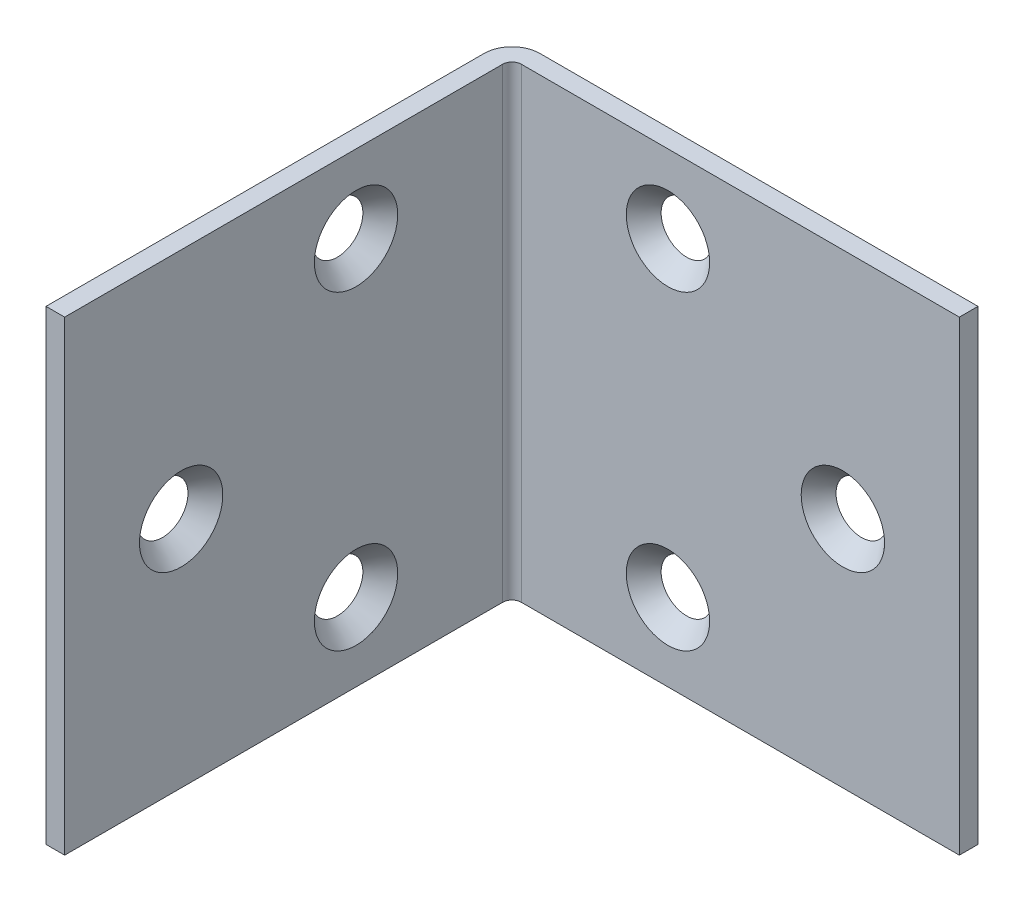
from build123d import *

# Parameters (mm, degrees)
EXTRUDE_THIN1_START          = -19.05
EXTRUDE_THIN1_DEPTH          = 38.1
SKETCH4_R                    = 2.0828
EXTRUDE3_DEPTH               = 57.145492036
SKETCH5_R                    = 2.0828
CUT_EXTRUDE1_DEPTH           = 2.54
CUT_EXTRUDE1_DRAFT           = 41
CUT_EXTRUDE1_PROFILE_2_DEPTH = 2.54
CUT_EXTRUDE1_PROFILE_2_DRAFT = 41
CUT_EXTRUDE1_PROFILE_3_DEPTH = 2.54
CUT_EXTRUDE1_PROFILE_3_DRAFT = 41
MIRROR1_COPY_1_SKETCH_R      = 2.0828
MIRROR1_COPY_1_DEPTH         = 2.54
MIRROR1_COPY_1_DRAFT         = 41
MIRROR1_COPY_2_SKETCH_R      = 2.0828
MIRROR1_COPY_2_DEPTH         = 2.54
MIRROR1_COPY_2_DRAFT         = 41
MIRROR1_COPY_3_SKETCH_R      = 2.0828
MIRROR1_COPY_3_DEPTH         = 2.54
MIRROR1_COPY_3_DRAFT         = 41
MIRROR1_COPY_4_SKETCH_R      = 2.0828
MIRROR1_COPY_4_DEPTH         = 2.54
MIRROR1_COPY_4_DRAFT         = 41
MIRROR1_COPY_5_SKETCH_R      = 2.0828
MIRROR1_COPY_5_DEPTH         = 2.54
MIRROR1_COPY_5_DRAFT         = 41


# Read off the part's stored shape, not the designer's step: Extrude-Thin1
with BuildPart() as part:
    # Extrude-Thin1 outline → Extrude-Thin1 (new body)
    with BuildSketch(Plane(origin=(0, 0, 0), x_dir=(1, 0, 0), z_dir=(0, 1, 0)).offset(EXTRUDE_THIN1_START)):
        with BuildLine():
            Line((2.286, -1.524), (38.1, -1.524))
            Line((38.1, -1.524), (38.1, 0))
            Line((38.1, 0), (2.286, 0))
            ThreePointArc((2.286, 0), (0.669553898, -0.669553898), (0, -2.286))
            Line((0, -2.286), (0, -38.1))
            Line((0, -38.1), (1.524, -38.1))
            Line((1.524, -38.1), (1.524, -2.286))
            ThreePointArc((1.524, -2.286), (1.747184633, -1.747184633), (2.286, -1.524))
        make_face()
    extrude(amount=EXTRUDE_THIN1_DEPTH)

    # Sketch4 → Extrude3 (cut, through all)
    with BuildSketch(Plane(origin=(1.524, 0, 0), x_dir=(0, 0, -1), z_dir=(1, 0, 0))):
        with Locations((-28.575, 0)):
            Circle(SKETCH4_R)
        with Locations((-14.2748, 12.7)):
            Circle(SKETCH4_R)
        with Locations((-14.2748, -12.7)):
            Circle(SKETCH4_R)
    extrude3 = extrude(amount=-EXTRUDE3_DEPTH, mode=Mode.SUBTRACT)


with BuildPart() as cut_extrude1_tool:
    # Sketch5 → Cut-Extrude1 (with draft: the straight prism first)
    with BuildSketch(Plane.ZY):
        with Locations((14.2748, -12.7)):
            Circle(SKETCH5_R)
    extrude(amount=-CUT_EXTRUDE1_DEPTH)
    # Cut-Extrude1: the draft: its side faces are tilted about the plane it starts from
    cut_extrude1_sides = [cut_extrude1_tool.faces().sort_by_distance(p)[0] for p in [
        (1.27, -12.7, 12.192),
    ]]
    draft(cut_extrude1_sides, Plane.ZY, CUT_EXTRUDE1_DRAFT)


with BuildPart() as part_1:
    add(part.part)

    # Cut-Extrude1: cut by cut_extrude1_tool
    add(cut_extrude1_tool.part, mode=Mode.SUBTRACT)


with BuildPart() as cut_extrude1_profile_2_tool:
    # Sketch5 → Cut-Extrude1 profile 2 (with draft: the straight prism first)
    with BuildSketch(Plane.ZY):
        with Locations((14.2748, 12.7)):
            Circle(SKETCH5_R)
    extrude(amount=-CUT_EXTRUDE1_PROFILE_2_DEPTH)
    # Cut-Extrude1 profile 2: the draft: its side faces are tilted about the plane it starts from
    cut_extrude1_profile_2_sides = [cut_extrude1_profile_2_tool.faces().sort_by_distance(p)[0] for p in [
        (1.27, 12.7, 12.192),
    ]]
    draft(cut_extrude1_profile_2_sides, Plane.ZY, CUT_EXTRUDE1_PROFILE_2_DRAFT)


with BuildPart() as part_2:
    add(part_1.part)

    # Cut-Extrude1 profile 2: cut by cut_extrude1_profile_2_tool
    add(cut_extrude1_profile_2_tool.part, mode=Mode.SUBTRACT)


with BuildPart() as cut_extrude1_profile_3_tool:
    # Sketch5 → Cut-Extrude1 profile 3 (with draft: the straight prism first)
    with BuildSketch(Plane.ZY):
        with Locations((28.575, 0)):
            Circle(SKETCH5_R)
    extrude(amount=-CUT_EXTRUDE1_PROFILE_3_DEPTH)
    # Cut-Extrude1 profile 3: the draft: its side faces are tilted about the plane it starts from
    cut_extrude1_profile_3_sides = [cut_extrude1_profile_3_tool.faces().sort_by_distance(p)[0] for p in [
        (1.27, 0, 26.4922),
    ]]
    draft(cut_extrude1_profile_3_sides, Plane.ZY, CUT_EXTRUDE1_PROFILE_3_DRAFT)


with BuildPart() as part_3:
    add(part_2.part)

    # Cut-Extrude1 profile 3: cut by cut_extrude1_profile_3_tool
    add(cut_extrude1_profile_3_tool.part, mode=Mode.SUBTRACT)

    # Mirror1: Extrude3 across plane
    add(extrude3.mirror(Plane(origin=(0, 0, 0), x_dir=(0.7071067811865465, 0, 0.7071067811865486), z_dir=(-0.7071067811865488, 0, 0.7071067811865464))), mode=Mode.SUBTRACT)


with BuildPart() as mirror1_copy_1_tool:
    # Mirror1 copy 1 sketch → Mirror1 copy 1 (with draft: the straight prism first)
    with BuildSketch(Plane(origin=(0, 0, 0), x_dir=(1, 0, 0), z_dir=(0, 0, -1))):
        with Locations((14.2748, 12.7)):
            Circle(MIRROR1_COPY_1_SKETCH_R)
    extrude(amount=-MIRROR1_COPY_1_DEPTH)
    # Mirror1 copy 1: the draft: its side faces are tilted about the plane it starts from
    mirror1_copy_1_sides = [mirror1_copy_1_tool.faces().sort_by_distance(p)[0] for p in [
        (12.192, -12.7, 1.27),
    ]]
    draft(mirror1_copy_1_sides, Plane(origin=(0, 0, 0), x_dir=(1, 0, 0), z_dir=(0, 0, -1)), MIRROR1_COPY_1_DRAFT)


with BuildPart() as part_4:
    add(part_3.part)

    # Mirror1 copy 1: cut by mirror1_copy_1_tool
    add(mirror1_copy_1_tool.part, mode=Mode.SUBTRACT)


with BuildPart() as mirror1_copy_2_tool:
    # Mirror1 copy 2 sketch → Mirror1 copy 2 (with draft: the straight prism first)
    with BuildSketch(Plane(origin=(0, 0, 0), x_dir=(1, 0, 0), z_dir=(0, 0, -1))):
        with Locations((14.2748, -12.7)):
            Circle(MIRROR1_COPY_2_SKETCH_R)
    extrude(amount=-MIRROR1_COPY_2_DEPTH)
    # Mirror1 copy 2: the draft: its side faces are tilted about the plane it starts from
    mirror1_copy_2_sides = [mirror1_copy_2_tool.faces().sort_by_distance(p)[0] for p in [
        (12.192, 12.7, 1.27),
    ]]
    draft(mirror1_copy_2_sides, Plane(origin=(0, 0, 0), x_dir=(1, 0, 0), z_dir=(0, 0, -1)), MIRROR1_COPY_2_DRAFT)


with BuildPart() as part_5:
    add(part_4.part)

    # Mirror1 copy 2: cut by mirror1_copy_2_tool
    add(mirror1_copy_2_tool.part, mode=Mode.SUBTRACT)


with BuildPart() as mirror1_copy_3_tool:
    # Mirror1 copy 3 sketch → Mirror1 copy 3 (with draft: the straight prism first)
    with BuildSketch(Plane(origin=(0, 0, 0), x_dir=(1, 0, 0), z_dir=(0, 0, -1))):
        with Locations((28.575, 0)):
            Circle(MIRROR1_COPY_3_SKETCH_R)
    extrude(amount=-MIRROR1_COPY_3_DEPTH)
    # Mirror1 copy 3: the draft: its side faces are tilted about the plane it starts from
    mirror1_copy_3_sides = [mirror1_copy_3_tool.faces().sort_by_distance(p)[0] for p in [
        (26.4922, 0, 1.27),
    ]]
    draft(mirror1_copy_3_sides, Plane(origin=(0, 0, 0), x_dir=(1, 0, 0), z_dir=(0, 0, -1)), MIRROR1_COPY_3_DRAFT)


with BuildPart() as part_6:
    add(part_5.part)

    # Mirror1 copy 3: cut by mirror1_copy_3_tool
    add(mirror1_copy_3_tool.part, mode=Mode.SUBTRACT)


with BuildPart() as mirror1_copy_4_tool:
    # Mirror1 copy 4 sketch → Mirror1 copy 4 (with draft: the straight prism first)
    with BuildSketch(Plane(origin=(0, 0, 0), x_dir=(1, 0, 0), z_dir=(0, 0, -1))):
        with Locations((14.2748, -12.7)):
            Circle(MIRROR1_COPY_4_SKETCH_R)
    extrude(amount=-MIRROR1_COPY_4_DEPTH)
    # Mirror1 copy 4: the draft: its side faces are tilted about the plane it starts from
    mirror1_copy_4_sides = [mirror1_copy_4_tool.faces().sort_by_distance(p)[0] for p in [
        (12.192, 12.7, 1.27),
    ]]
    draft(mirror1_copy_4_sides, Plane(origin=(0, 0, 0), x_dir=(1, 0, 0), z_dir=(0, 0, -1)), MIRROR1_COPY_4_DRAFT)


with BuildPart() as part_7:
    add(part_6.part)

    # Mirror1 copy 4: cut by mirror1_copy_4_tool
    add(mirror1_copy_4_tool.part, mode=Mode.SUBTRACT)


with BuildPart() as mirror1_copy_5_tool:
    # Mirror1 copy 5 sketch → Mirror1 copy 5 (with draft: the straight prism first)
    with BuildSketch(Plane(origin=(0, 0, 0), x_dir=(1, 0, 0), z_dir=(0, 0, -1))):
        with Locations((28.575, 0)):
            Circle(MIRROR1_COPY_5_SKETCH_R)
    extrude(amount=-MIRROR1_COPY_5_DEPTH)
    # Mirror1 copy 5: the draft: its side faces are tilted about the plane it starts from
    mirror1_copy_5_sides = [mirror1_copy_5_tool.faces().sort_by_distance(p)[0] for p in [
        (26.4922, 0, 1.27),
    ]]
    draft(mirror1_copy_5_sides, Plane(origin=(0, 0, 0), x_dir=(1, 0, 0), z_dir=(0, 0, -1)), MIRROR1_COPY_5_DRAFT)


with BuildPart() as part_8:
    add(part_7.part)

    # Mirror1 copy 5: cut by mirror1_copy_5_tool
    add(mirror1_copy_5_tool.part, mode=Mode.SUBTRACT)


solid = part_8.part
